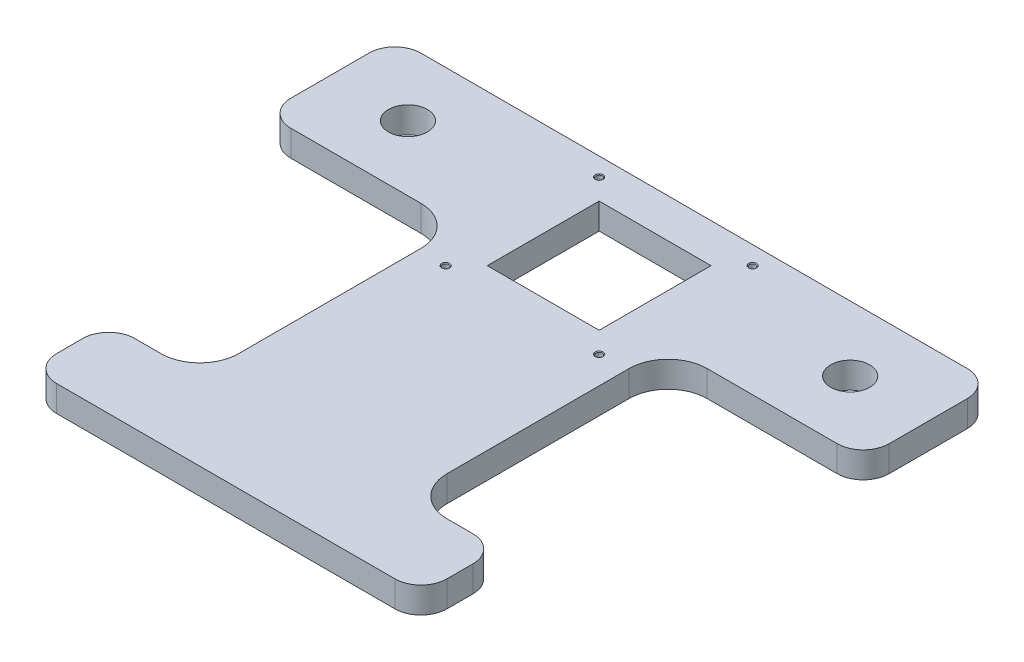
from build123d import *

# Parameters (mm, degrees)
AUFSATZ_LINEAR_AUSTRAGEN1_DEPTH  = 10
F_15_0_15_DURCHMESSER_BOHRUNG1_D = 15
SKIZZE8_W                        = 43
SKIZZE8_H                        = 43
SCHNITT_LINEAR_AUSTRAGEN2_DEPTH  = 10
M3_GEWINDEBOHRUNG1_D             = 2.5
M3_GEWINDEBOHRUNG1_DEPTH         = 8
M3_GEWINDEBOHRUNG1_CSINK_D       = 3.05
M3_GEWINDEBOHRUNG1_CSINK_ANGLE   = 90
M3_GEWINDEBOHRUNG1_TIP           = 0.751075774


with BuildPart() as part:
    # Skizze1 → Aufsatz-Linear austragen1 (new body)
    with BuildSketch(Plane(origin=(0, 0, 0), x_dir=(1, 0, 0), z_dir=(0, 1, 0))):
        with BuildLine():
            Line((-105, 90), (105, 90))
            ThreePointArc((105, 90), (112.071067812, 87.071067812), (115, 80))
            Line((115, 80), (115, 50))
            ThreePointArc((115, 50), (112.071067812, 42.928932188), (105, 40))
            Line((105, 40), (55, 40))
            ThreePointArc((55, 40), (44.393398282, 35.606601718), (40, 25))
            Line((40, 25), (40, -45))
            ThreePointArc((40, -45), (44.393398282, -55.606601718), (55, -60))
            Line((55, -60), (65, -60))
            ThreePointArc((65, -60), (72.071067812, -62.928932188), (75, -70))
            Line((75, -70), (75, -80))
            ThreePointArc((75, -80), (72.071067812, -87.071067812), (65, -90))
            Line((65, -90), (-65, -90))
            ThreePointArc((-65, -90), (-72.071067812, -87.071067812), (-75, -80))
            Line((-75, -80), (-75, -70))
            ThreePointArc((-75, -70), (-72.071067812, -62.928932188), (-65, -60))
            Line((-65, -60), (-55, -60))
            ThreePointArc((-55, -60), (-44.393398282, -55.606601718), (-40, -45))
            Line((-40, -45), (-40, 25))
            ThreePointArc((-40, 25), (-44.393398282, 35.606601718), (-55, 40))
            Line((-55, 40), (-105, 40))
            ThreePointArc((-105, 40), (-112.071067812, 42.928932188), (-115, 50))
            Line((-115, 50), (-115, 80))
            ThreePointArc((-115, 80), (-112.071067812, 87.071067812), (-105, 90))
        make_face()
    extrude(amount=AUFSATZ_LINEAR_AUSTRAGEN1_DEPTH)

    # Ø15.0 (15) Durchmesser Bohrung1 (through all)
    with Locations(Plane(origin=(0, 10, 0), x_dir=(1, 0, 0), z_dir=(0, 1, 0))):
        with Locations((-85, 65), (85, 65)):
            Hole(F_15_0_15_DURCHMESSER_BOHRUNG1_D / 2)

    # Skizze8 → Schnitt-Linear austragen2 (cut)
    with BuildSketch(Plane(origin=(0, 10, 0), x_dir=(1, 0, 0), z_dir=(0, 1, 0))):
        with Locations((0, 53.5)):
            Rectangle(SKIZZE8_W, SKIZZE8_H)
    extrude(amount=-SCHNITT_LINEAR_AUSTRAGEN2_DEPTH, mode=Mode.SUBTRACT)

    # M3 Gewindebohrung1
    with Locations(Plane(origin=(0, 10, 0), x_dir=(1, 0, 0), z_dir=(0, 1, 0))):
        with Locations((-29.5, 83), (-29.5, 24), (29.5, 24), (29.5, 83)):
            CounterSinkHole(M3_GEWINDEBOHRUNG1_D / 2, M3_GEWINDEBOHRUNG1_CSINK_D / 2, depth=M3_GEWINDEBOHRUNG1_DEPTH, counter_sink_angle=M3_GEWINDEBOHRUNG1_CSINK_ANGLE)
            with Locations((0, 0, -(M3_GEWINDEBOHRUNG1_DEPTH + M3_GEWINDEBOHRUNG1_TIP / 2))):  # 118° drill point
                Cone(0, M3_GEWINDEBOHRUNG1_D / 2, M3_GEWINDEBOHRUNG1_TIP, mode=Mode.SUBTRACT)


solid = part.part
